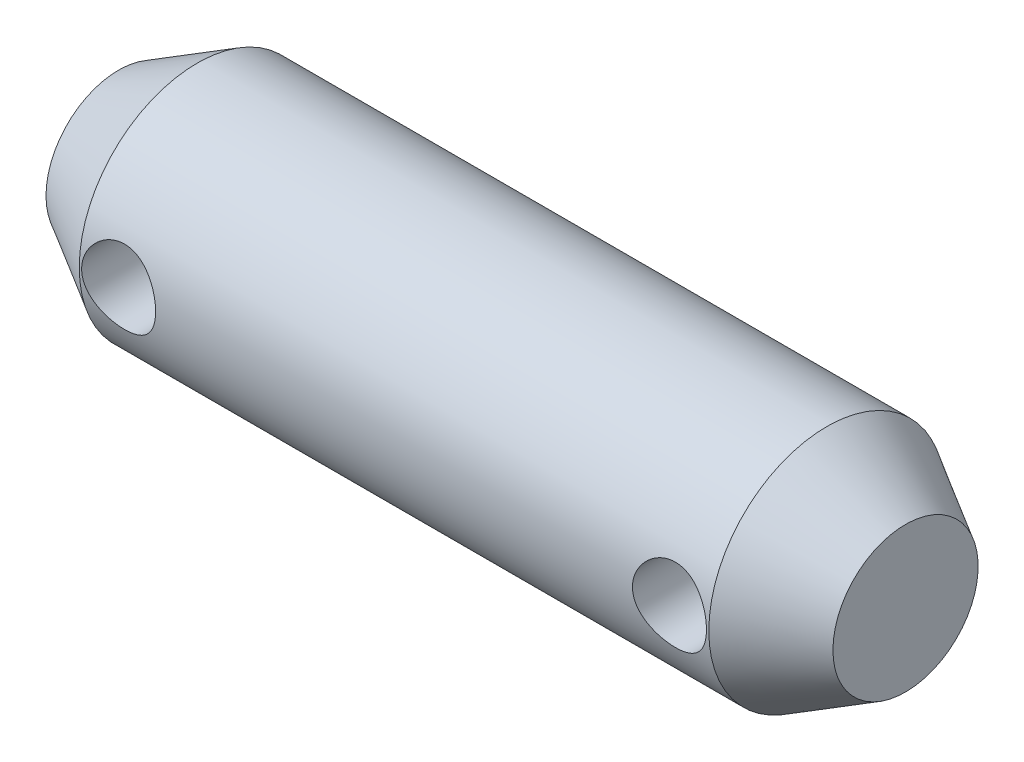
from build123d import *

# Parameters (mm, degrees)
HOLE_DEPTH      = 11.22252415
HOLE_DEPTH_BACK = 11.22252415
SKETCH2_R       = 0.47


with BuildPart() as part:
    # Sketch1 → Base-Revolve (revolve)
    with BuildSketch(Plane.XY):
        Polygon((10, 0), (10, 0.922649731), (9, 1.5), (1, 1.5), (0, 0.922649731), (0, 0), align=None)
    revolve(axis=Axis((-13.735799962, 0, 0), (1, 0, 0)))

    # Sketch2 → Hole (cut, two sides: drawn at the far end of the back side and taken through both)
    with BuildSketch(Plane.XY.offset(-HOLE_DEPTH_BACK)):
        with Locations((8.5, 0)):
            Circle(SKETCH2_R)
        with Locations((1.5, 0)):
            Circle(SKETCH2_R)
    extrude(amount=HOLE_DEPTH + HOLE_DEPTH_BACK, mode=Mode.SUBTRACT)


solid = part.part
